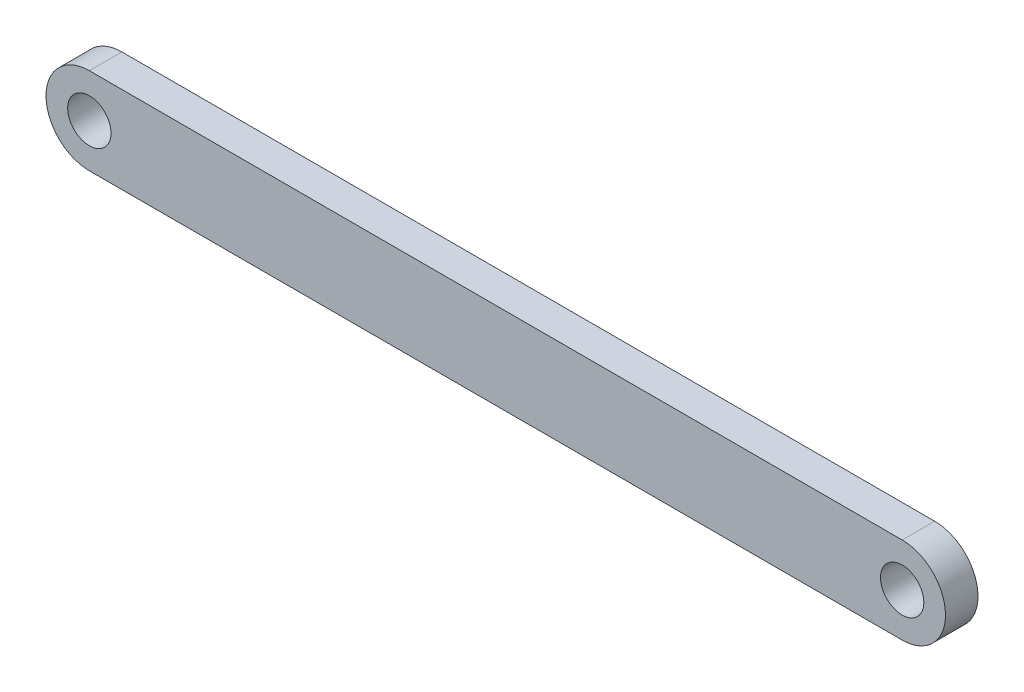
from build123d import *

# Parameters (mm, degrees)
SKETCH1_R           = 2
BOSS_EXTRUDE1_DEPTH = 3


with BuildPart() as part:
    # Sketch1 → Boss-Extrude1 (new body)
    with BuildSketch(Plane(origin=(0, 34.703080777, 0), x_dir=(1, 0, 0), z_dir=(0, 0, 1))):
        with BuildLine():
            Line((-30.372366657, 17.432635687), (44.627633343, 17.432635687))
            ThreePointArc((44.627633343, 17.432635687), (48.627633343, 13.432635687), (44.627633343, 9.432635687))
            Line((44.627633343, 9.432635687), (-30.372366657, 9.432635687))
            ThreePointArc((-30.372366657, 9.432635687), (-34.372366657, 13.432635687), (-30.372366657, 17.432635687))
        make_face()
        with Locations((-30.372366657, 13.432635687)):
            Circle(SKETCH1_R, mode=Mode.SUBTRACT)
        with Locations((44.627633343, 13.432635687)):
            Circle(SKETCH1_R, mode=Mode.SUBTRACT)
    extrude(amount=BOSS_EXTRUDE1_DEPTH)


solid = part.part
